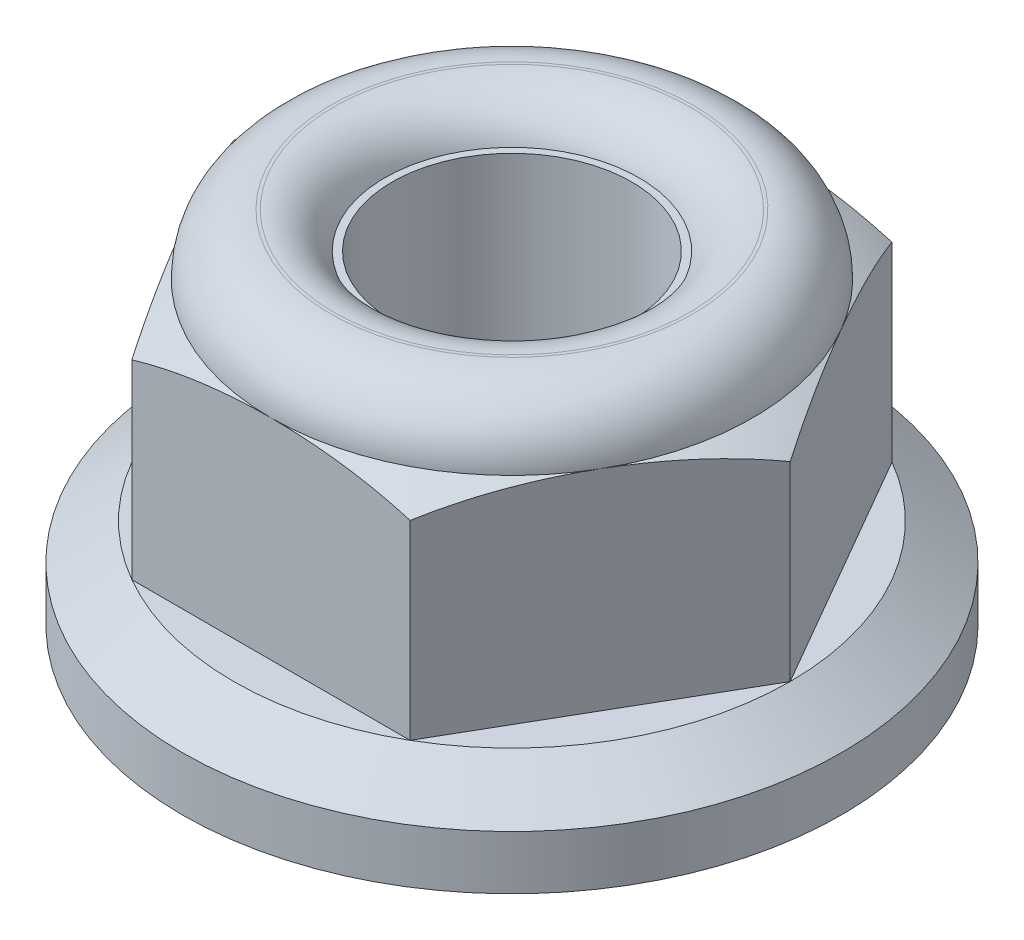
from build123d import *

# Parameters (mm, degrees)
SKETCH1_R               = 5.5
BOSS_EXTRUDE1_DEPTH     = 1.5
CHAMFER1_SIZE           = 0.6
CHAMFER1_SIZE2          = 0.856888804
BOSS_EXTRUDE2_DEPTH     = 3.5
SKETCH3_R               = 4.021052248
BOSS_EXTRUDE3_DEPTH     = 1
SKETCH5_R               = 2.121052248
CUT_EXTRUDE1_DEPTH      = 0.6
FILLET1_R               = 0.9
CUT_EXTRUDE2_DEPTH      = 10.468896451
CUT_EXTRUDE2_DEPTH_BACK = 10.468896451
SKETCH6_R               = 2


with BuildPart() as part:
    # Sketch1 → Boss-Extrude1 (new body)
    with BuildSketch(Plane(origin=(0, 0, 0), x_dir=(1, 0, 0), z_dir=(0, 1, 0))):
        with Locations(Location((0, 0, 0), (0, 0, 270))):
            Circle(SKETCH1_R)
    extrude(amount=BOSS_EXTRUDE1_DEPTH)

    # Chamfer1
    chamfer1_edges = [part.edges().sort_by_distance(p)[0] for p in [
        (0, 1.5, -5.5),
    ]]
    chamfer1_side = [part.faces().sort_by_distance(p)[0] for p in [
        (0, 0.75, -5.5),
    ]]
    chamfer(chamfer1_edges, length=CHAMFER1_SIZE, length2=CHAMFER1_SIZE2, reference=chamfer1_side[0])

    # Sketch2 → Boss-Extrude2 (add)
    with BuildSketch(Plane(origin=(0, 1.5, 0), x_dir=(1, 0, 0), z_dir=(0, 1, 0))):
        Polygon((4.643111196, 0), (2.321555598, 4.021052248), (-2.321555598, 4.021052248), (-4.643111196, 0), (-2.321555598, -4.021052248), (2.321555598, -4.021052248), align=None)
    extrude(amount=BOSS_EXTRUDE2_DEPTH)

    # Sketch3 → Boss-Extrude3 (add)
    with BuildSketch(Plane(origin=(0, 5, 0), x_dir=(1, 0, 0), z_dir=(0, 1, 0))):
        with Locations(Location((0, 0, 0), (0, 0, 270))):
            Circle(SKETCH3_R)
    extrude(amount=BOSS_EXTRUDE3_DEPTH)

    # Sketch4 → Cut-Revolve1 (revolve, cut)
    with BuildSketch(Plane.XY, mode=Mode.PRIVATE) as cut_revolve1_sk:
        with BuildLine():
            Line((6.63749378, 2.793667141), (6.63749378, 7.491604904))
            Line((6.63749378, 7.491604904), (3.021052248, 7.491604904))
            Line((3.021052248, 7.491604904), (3.021052248, 6))
            ThreePointArc((3.021052248, 6), (3.728159029, 5.707106781), (4.021052248, 5))
            ThreePointArc((4.021052248, 5), (5.485320065, 4.081886331), (6.63749378, 2.793667141))
        make_face()
    revolve(cut_revolve1_sk.sketch.rotate(Axis((0, 6, 0), (0, 1, 0)), 60), axis=Axis((0, 6, 0), (0, 1, 0)), mode=Mode.SUBTRACT)

    # Sketch5 → Cut-Extrude1 (cut)
    with BuildSketch(Plane(origin=(0, 6, 0), x_dir=(1, 0, 0), z_dir=(0, 1, 0))):
        with Locations(Location((0, 0, 0), (0, 0, 270))):
            Circle(SKETCH5_R)
    extrude(amount=-CUT_EXTRUDE1_DEPTH, mode=Mode.SUBTRACT)

    # Fillet1
    # the kernel refuses this fillet: 0.9 mm, written as the material it takes off along each edge
    with BuildSketch(Plane(origin=(0, 6, 0), x_dir=(0, 0, 1), z_dir=(-1, 0, 0))) as fillet1_piece_1:
        with BuildLine():
            CenterArc((2.969580386, -0.9), FILLET1_R, 90, 70.528779366)
            Line((2.121052248, -0.6), (2.104081686, -0.594))
            ThreePointArc((2.104081686, -0.594), (2.103052248, -0.3), (2.103052248, 0))
            Line((2.103052248, 0), (2.121052248, 0.018))
            Line((2.121052248, 0.018), (2.969580386, 0.018))
            Line((2.969580386, 0.018), (2.969580386, 0))
        make_face()
    revolve(axis=Axis((0, 6, 0), (0, 1, 0)), mode=Mode.SUBTRACT)

    # Sketch6 → Cut-Extrude2 (cut, two sides: drawn at the far end of the back side and taken through both)
    with BuildSketch(Plane(origin=(0, 5.4, 0), x_dir=(1, 0, 0), z_dir=(0, 1, 0)).offset(-CUT_EXTRUDE2_DEPTH_BACK)):
        with Locations(Location((0, 0, 0), (0, 0, 270))):
            Circle(SKETCH6_R)
    extrude(amount=CUT_EXTRUDE2_DEPTH + CUT_EXTRUDE2_DEPTH_BACK, mode=Mode.SUBTRACT)


solid = part.part
